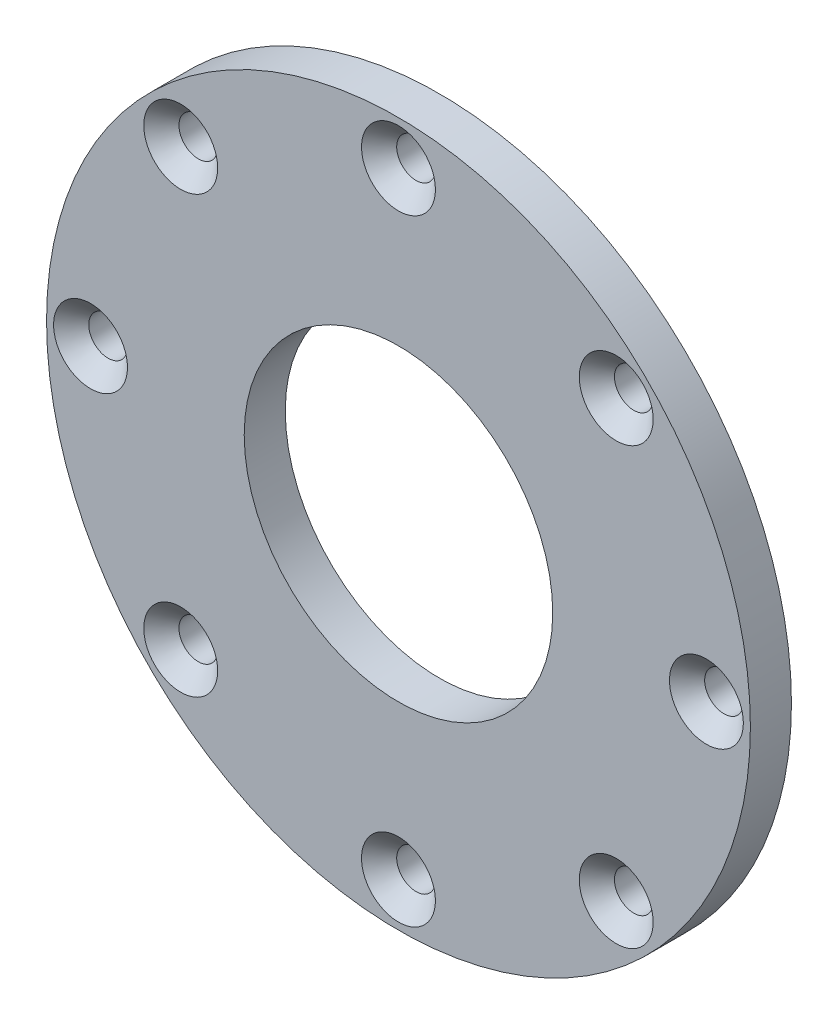
from build123d import *

# Parameters (mm, degrees)
SKETCH1_R                                           = 60
SKETCH1_R_2                                         = 26.3
BOSS_EXTRUDE1_DEPTH                                 = 7
CSK_FOR_M6_COUNTERSUNK_FLAT_HEAD_SCREW1_D           = 6.6
CSK_FOR_M6_COUNTERSUNK_FLAT_HEAD_SCREW1_CSINK_D     = 12.6
CSK_FOR_M6_COUNTERSUNK_FLAT_HEAD_SCREW1_CSINK_ANGLE = 90


with BuildPart() as part:
    # Sketch1 → Boss-Extrude1 (new body)
    with BuildSketch(Plane.XY):
        Circle(SKETCH1_R)
        Circle(SKETCH1_R_2, mode=Mode.SUBTRACT)
    extrude(amount=BOSS_EXTRUDE1_DEPTH)

    # CSK for M6 Countersunk Flat Head Screw1 (through all)
    with Locations(Plane.XY.offset(7)):
        with Locations((-37.123106012, 37.123106012), (0, 52.5), (37.123106012, 37.123106012), (52.5, 0), (37.123106012, -37.123106012), (0, -52.5), (-37.123106012, -37.123106012), (-52.5, 0)):
            CounterSinkHole(CSK_FOR_M6_COUNTERSUNK_FLAT_HEAD_SCREW1_D / 2, CSK_FOR_M6_COUNTERSUNK_FLAT_HEAD_SCREW1_CSINK_D / 2, counter_sink_angle=CSK_FOR_M6_COUNTERSUNK_FLAT_HEAD_SCREW1_CSINK_ANGLE)


solid = part.part
